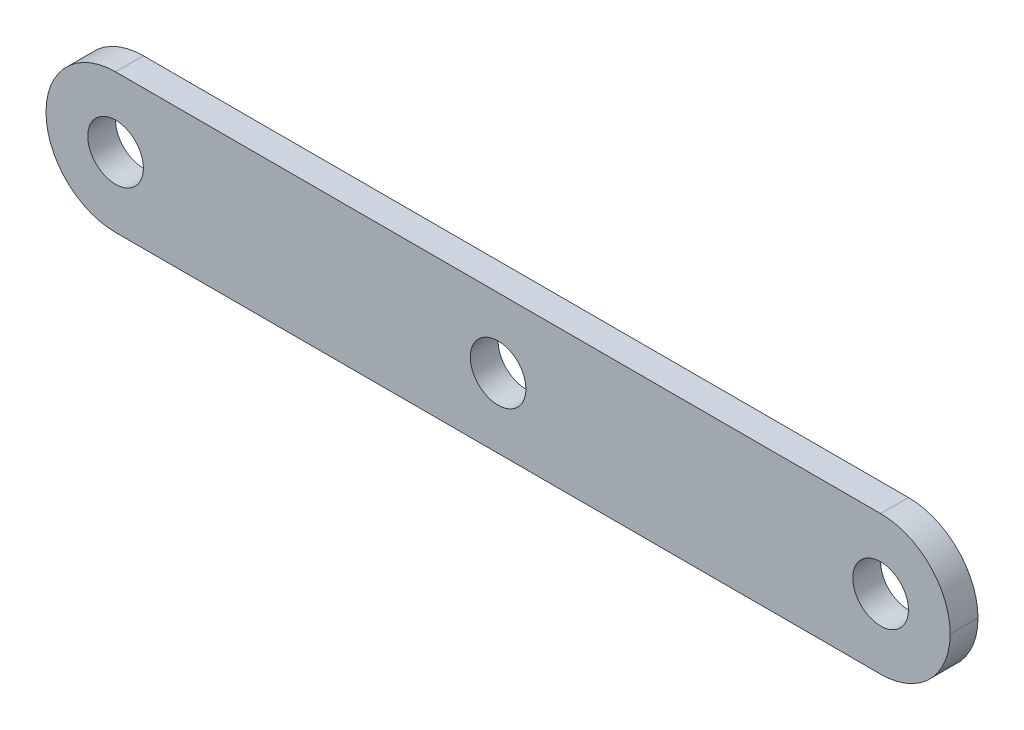
from build123d import *

# Parameters (mm, degrees)
SKETCH_1_W          = 65
SKETCH_1_H          = 10
EXTRUDE_1_DEPTH     = 2
FILLET_1_R          = 5
SKETCH_3_R          = 2
CUT_EXTRUDE_1_DEPTH = 2


with BuildPart() as part:
    # 草图1 → 凸台-拉伸1 (new body)
    with BuildSketch(Plane.XY):
        Rectangle(SKETCH_1_W, SKETCH_1_H)
    extrude(amount=EXTRUDE_1_DEPTH)

    # 圆角1
    fillet_1_edges = [part.edges().sort_by_distance(p)[0] for p in [
        (32.5, -5, 1),
        (-32.5, -5, 1),
        (-32.5, 5, 1),
        (32.5, 5, 1),
    ]]
    fillet(fillet_1_edges, radius=FILLET_1_R - 0.0001)  # a hair under: the kernel refuses the full size

    # 草图3 → 切除-拉伸1 (cut)
    with BuildSketch(Plane.XY.offset(2)):
        with Locations((-27.5, 0)):
            Circle(SKETCH_3_R)
        with Locations(Location((27.5, 0, 0), (0, 0, 180))):
            Circle(SKETCH_3_R)
        Circle(SKETCH_3_R)
    extrude(amount=-CUT_EXTRUDE_1_DEPTH, mode=Mode.SUBTRACT)


solid = part.part
